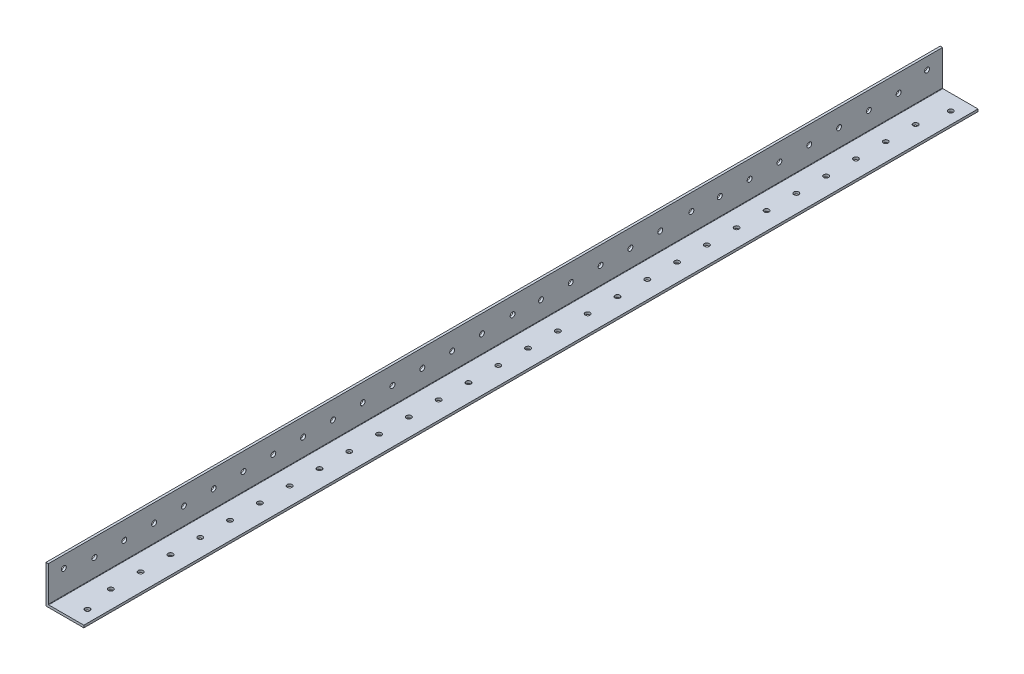
from build123d import *

# Parameters (mm, degrees)
BOSS_EXTRUDE1_DEPTH = 1219.2
FILLET1_R           = 0.254
SKETCH4_W           = 1838.4
SKETCH4_H           = 74.945320812
CUT_EXTRUDE1_DEPTH  = 60
SKETCH5_R           = 1.65
CUT_EXTRUDE2_DEPTH  = 10
SKETCH9_R           = 1.65
CUT_EXTRUDE6_DEPTH  = 60


with BuildPart() as part:
    # Sketch3 → Boss-Extrude1 (new, symmetric)
    with BuildSketch(Plane.XY):
        Polygon((1.5875, 25.4), (0, 25.4), (0, 0), (25.4, 0), (25.4, 1.5875), (1.5875, 1.5875), align=None)
    extrude(amount=BOSS_EXTRUDE1_DEPTH, both=True)

    # Fillet1
    fillet1_edges = [part.edges().sort_by_distance(p)[0] for p in [
        (1.5875, 1.5875, 0),
    ]]
    fillet(fillet1_edges, radius=FILLET1_R)

    # Sketch4 → Cut-Extrude1 (cut)
    with BuildSketch(Plane.ZY):
        with Locations((-300, 37.472660406)):
            Rectangle(SKETCH4_W, SKETCH4_H)
    extrude(amount=-CUT_EXTRUDE1_DEPTH, mode=Mode.SUBTRACT)

    # Sketch5 → Cut-Extrude2 (cut)
    with BuildSketch(Plane(origin=(0, 1.5875, 0), x_dir=(1, 0, 0), z_dir=(0, 1, 0))):
        with Locations((17.4625, -629.5759)):
            Circle(SKETCH5_R)
        with Locations((17.4625, -1208.8241)):
            Circle(SKETCH5_R)
        with Locations((13.49375, -1189.2)):
            Circle(SKETCH5_R)
        with Locations((13.49375, -1169.2)):
            Circle(SKETCH5_R)
        with Locations((13.49375, -1149.2)):
            Circle(SKETCH5_R)
        with Locations((13.49375, -1129.2)):
            Circle(SKETCH5_R)
        with Locations((13.49375, -1109.2)):
            Circle(SKETCH5_R)
        with Locations((13.49375, -1089.2)):
            Circle(SKETCH5_R)
        with Locations((13.49375, -1069.2)):
            Circle(SKETCH5_R)
        with Locations((13.49375, -1049.2)):
            Circle(SKETCH5_R)
        with Locations((13.49375, -1029.2)):
            Circle(SKETCH5_R)
        with Locations((13.49375, -1009.2)):
            Circle(SKETCH5_R)
        with Locations((13.49375, -989.2)):
            Circle(SKETCH5_R)
        with Locations((13.49375, -969.2)):
            Circle(SKETCH5_R)
        with Locations((13.49375, -949.2)):
            Circle(SKETCH5_R)
        with Locations((13.49375, -929.2)):
            Circle(SKETCH5_R)
        with Locations((13.49375, -909.2)):
            Circle(SKETCH5_R)
        with Locations((13.49375, -889.2)):
            Circle(SKETCH5_R)
        with Locations((13.49375, -869.2)):
            Circle(SKETCH5_R)
        with Locations((13.49375, -849.2)):
            Circle(SKETCH5_R)
        with Locations((13.49375, -829.2)):
            Circle(SKETCH5_R)
        with Locations((13.49375, -809.2)):
            Circle(SKETCH5_R)
        with Locations((13.49375, -789.2)):
            Circle(SKETCH5_R)
        with Locations((13.49375, -769.2)):
            Circle(SKETCH5_R)
        with Locations((13.49375, -749.2)):
            Circle(SKETCH5_R)
        with Locations((13.49375, -729.2)):
            Circle(SKETCH5_R)
        with Locations((13.49375, -709.2)):
            Circle(SKETCH5_R)
        with Locations((13.49375, -689.2)):
            Circle(SKETCH5_R)
        with Locations((13.49375, -669.2)):
            Circle(SKETCH5_R)
        with Locations((13.49375, -649.2)):
            Circle(SKETCH5_R)
    extrude(amount=-CUT_EXTRUDE2_DEPTH, mode=Mode.SUBTRACT)

    # Sketch9 → Cut-Extrude6 (cut)
    with BuildSketch(Plane(origin=(1.5875, 0, 0), x_dir=(0, 0, -1), z_dir=(1, 0, 0))):
        with Locations((-629.5759, 17.4625)):
            Circle(SKETCH9_R)
        with Locations((-1208.8241, 17.463)):
            Circle(SKETCH9_R)
        with Locations((-1188.258925, 13.49375)):
            Circle(SKETCH9_R)
        with Locations((-1168.258925, 13.49375)):
            Circle(SKETCH9_R)
        with Locations((-1148.258925, 13.49375)):
            Circle(SKETCH9_R)
        with Locations((-1128.258925, 13.49375)):
            Circle(SKETCH9_R)
        with Locations((-1108.258925, 13.49375)):
            Circle(SKETCH9_R)
        with Locations((-1088.258925, 13.49375)):
            Circle(SKETCH9_R)
        with Locations((-1068.258925, 13.49375)):
            Circle(SKETCH9_R)
        with Locations((-1048.258925, 13.49375)):
            Circle(SKETCH9_R)
        with Locations((-1028.258925, 13.49375)):
            Circle(SKETCH9_R)
        with Locations((-1008.258925, 13.49375)):
            Circle(SKETCH9_R)
        with Locations((-988.258925, 13.49375)):
            Circle(SKETCH9_R)
        with Locations((-968.258925, 13.49375)):
            Circle(SKETCH9_R)
        with Locations((-948.258925, 13.49375)):
            Circle(SKETCH9_R)
        with Locations((-928.258925, 13.49375)):
            Circle(SKETCH9_R)
        with Locations((-787.69375, 14.2875)):
            Circle(SKETCH9_R)
        with Locations((-907.69375, 14.2875)):
            Circle(SKETCH9_R)
        with Locations((-648.634825, 13.49375)):
            Circle(SKETCH9_R)
        with Locations((-668.634825, 13.49375)):
            Circle(SKETCH9_R)
        with Locations((-688.634825, 13.49375)):
            Circle(SKETCH9_R)
        with Locations((-708.634825, 13.49375)):
            Circle(SKETCH9_R)
        with Locations((-728.634825, 13.49375)):
            Circle(SKETCH9_R)
        with Locations((-748.634825, 13.49375)):
            Circle(SKETCH9_R)
        with Locations((-768.634825, 13.49375)):
            Circle(SKETCH9_R)
        with Locations((-808.634825, 13.49375)):
            Circle(SKETCH9_R)
        with Locations((-828.634825, 13.49375)):
            Circle(SKETCH9_R)
        with Locations((-848.634825, 13.49375)):
            Circle(SKETCH9_R)
        with Locations((-868.634825, 13.49375)):
            Circle(SKETCH9_R)
        with Locations((-888.634825, 13.49375)):
            Circle(SKETCH9_R)
    extrude(amount=-CUT_EXTRUDE6_DEPTH, mode=Mode.SUBTRACT)


solid = part.part
